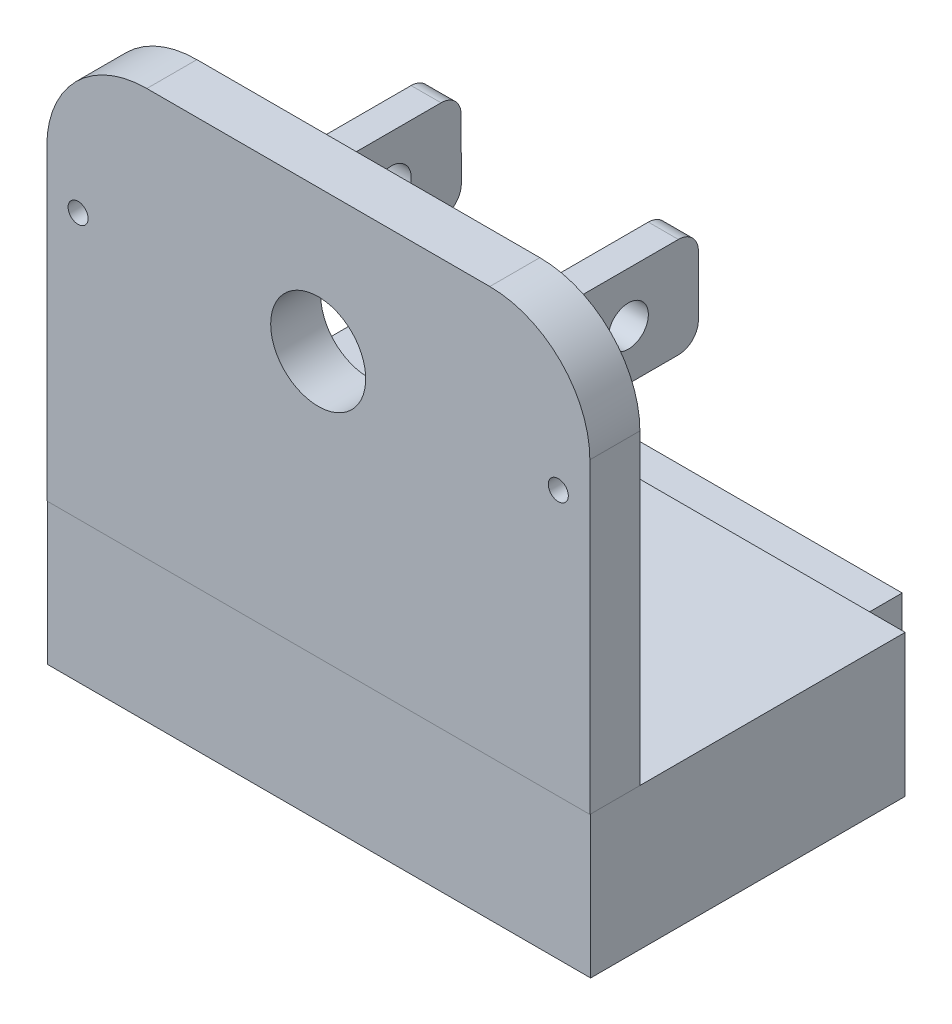
from build123d import *

# Parameters (mm, degrees)
BOSS_EXTRUDE1_DEPTH      = 11
BOSS_EXTRUDE1_DEPTH_BACK = 3.2
SKETCH1_W                = 54.3
SKETCH1_H                = 31.441999132
BOSS_EXTRUDE2_DEPTH      = 9.7
SKETCH3_W                = 54.281514795
SKETCH3_H                = 5
BOSS_EXTRUDE3_DEPTH      = 40.7
FILLET1_R                = 10
CUT_EXTRUDE2_DEPTH       = 21
CUT_EXTRUDE2_DEPTH_BACK  = 46
SKETCH4_R                = 4.75
SKETCH4_R_2              = 1
SKETCH11_W               = 3
SKETCH11_H               = 10
BOSS_EXTRUDE4_DEPTH      = 20
SKETCH11_2_W             = 3
SKETCH11_2_H             = 10
BOSS_EXTRUDE5_DEPTH      = 10
SKETCH12_R               = 2
CUT_EXTRUDE3_DEPTH       = 36
FILLET2_R                = 2


with BuildPart() as part:
    # Sketch1 → Boss-Extrude1 (new, two sides: drawn at the far end of the back side and taken through both)
    with BuildSketch(Plane(origin=(0, 0, 0), x_dir=(1, 0, 0), z_dir=(0, 1, 0)).offset(-BOSS_EXTRUDE1_DEPTH_BACK)):
        with Locations((0, -7.176016663)):
            Rectangle(SKETCH1_W, SKETCH1_H)
    extrude(amount=BOSS_EXTRUDE1_DEPTH + BOSS_EXTRUDE1_DEPTH_BACK)

    # Sketch2 → Boss-Extrude2 (add)
    with BuildSketch(Plane(origin=(0, 0, -8.544982903), x_dir=(-1, 0, 0), z_dir=(0, 0, -1))):
        Polygon((0, 4.557110743), (-17.15, 4.557110743), (-17.15, 1.043971306), (17.15, 1.043971306), (17.15, 4.557110743), align=None)
    extrude(amount=BOSS_EXTRUDE2_DEPTH)

    # Sketch3 → Boss-Extrude3 (add)
    with BuildSketch(Plane(origin=(0, 11, 0), x_dir=(1, 0, 0), z_dir=(0, 1, 0))):
        with Locations((0.013410524, -20.478188787)):
            Rectangle(SKETCH3_W, SKETCH3_H)
    extrude(amount=BOSS_EXTRUDE3_DEPTH)

    # Fillet1
    fillet1_edges = [part.edges().sort_by_distance(p)[0] for p in [
        (-27.127346874, 51.7, 20.478188787),
        (27.154167921, 51.7, 20.478188787),
    ]]
    fillet(fillet1_edges, radius=FILLET1_R)

    # Sketch4 → Cut-Extrude2 (cut, two sides: drawn at the far end of the back side and taken through both)
    with BuildSketch(Plane.XY.offset(22.897016229).offset(-CUT_EXTRUDE2_DEPTH_BACK)):
        with Locations((0, 37.5)):
            Circle(SKETCH4_R)
        with Locations((-24, 37.5)):
            Circle(SKETCH4_R_2)
        with Locations((24, 37.5)):
            Circle(SKETCH4_R_2)
    extrude(amount=CUT_EXTRUDE2_DEPTH + CUT_EXTRUDE2_DEPTH_BACK, mode=Mode.SUBTRACT)

    # Sketch11 → Boss-Extrude4 (add)
    with BuildSketch(Plane(origin=(0, 0, 17.978188787), x_dir=(-1, 0, 0), z_dir=(0, 0, -1))):
        with Locations((-11.5, 37.2)):
            Rectangle(SKETCH11_W, SKETCH11_H)
        Polygon((13.687484552, 32.160400012), (10.687497763, 32.169303039), (10.717174521, 42.169259003), (13.717161311, 42.160355976), align=None)
    extrude(amount=BOSS_EXTRUDE4_DEPTH)

    # Sketch11<2> → Boss-Extrude5 (add)
    with BuildSketch(Plane(origin=(0, 0, 17.978188787), x_dir=(-1, 0, 0), z_dir=(0, 0, -1))):
        with Locations((-11.5, 37.2)):
            Rectangle(SKETCH11_2_W, SKETCH11_2_H)
        Polygon((13.687484552, 32.160400012), (10.687497763, 32.169303039), (10.717174521, 42.169259003), (13.717161311, 42.160355976), align=None)
    extrude(amount=BOSS_EXTRUDE5_DEPTH)

    # Sketch12 → Cut-Extrude3 (cut)
    with BuildSketch(Plane(origin=(13, 0, 0), x_dir=(0, 0, -1), z_dir=(1, 0, 0))):
        with Locations((-4.978188787, 37.2)):
            Circle(SKETCH12_R)
    extrude(amount=-CUT_EXTRUDE3_DEPTH, mode=Mode.SUBTRACT)

    # Fillet2
    fillet2_edges = [part.edges().sort_by_distance(p)[0] for p in [
        (-12.187491158, 32.164851525, -2.021811213),
        (-12.217167916, 42.16480749, -2.021811213),
        (11.5, 32.2, -2.021811213),
        (11.5, 42.2, -2.021811213),
    ]]
    fillet(fillet2_edges, radius=FILLET2_R)


solid = part.part
